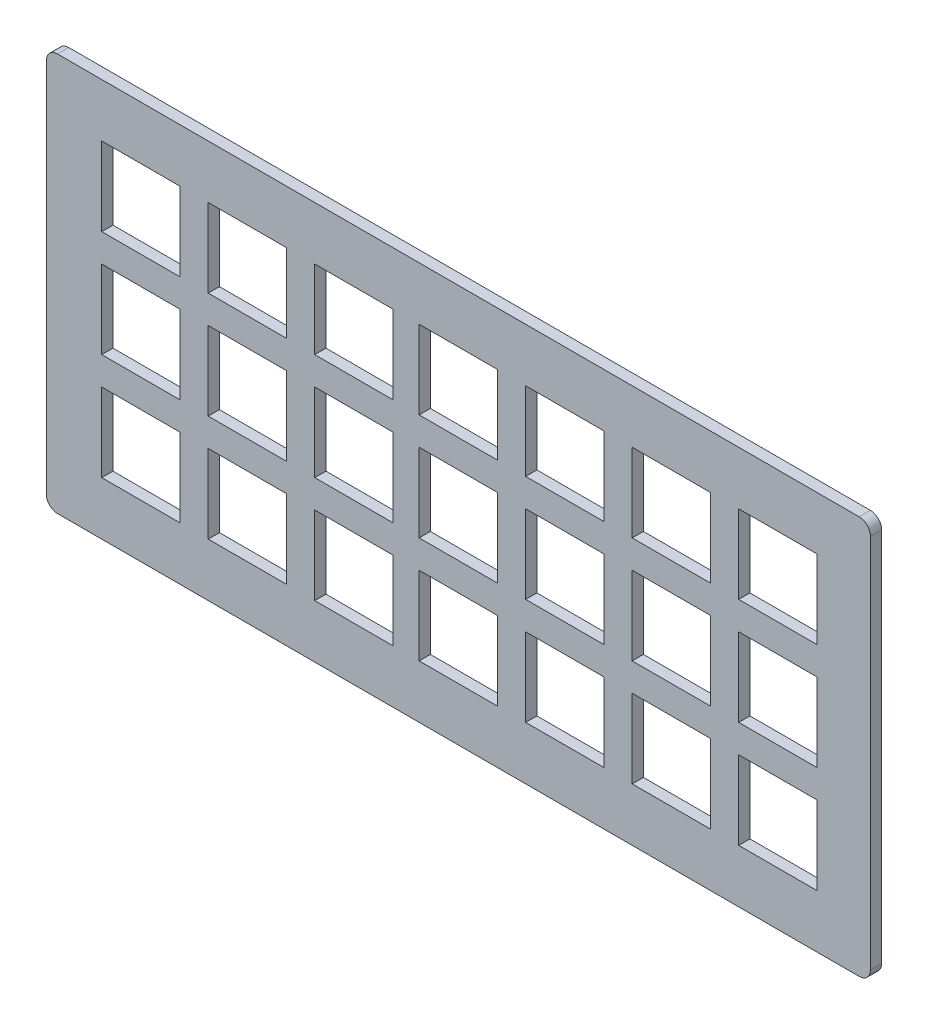
from build123d import *

# Parameters (mm, degrees)
MODEL_W             = 147
MODEL_H             = 71
MODEL_W_2           = 14
MODEL_H_2           = 14
BOSS_EXTRUDE1_DEPTH = 2
BREAK_CORNER1_DEPTH = 2


# Read off the part's stored shape, not the designer's step: Break-Corner1
with BuildPart() as part:
    # Model → Boss-Extrude1 (new body)
    with BuildSketch(Plane.XY):
        with Locations((125.770541641, 281.208862918)):
            Rectangle(MODEL_W, MODEL_H)
        with Locations((125.770541641, 262.208862918)):
            Rectangle(MODEL_W_2, MODEL_H_2, mode=Mode.SUBTRACT)
        with Locations((125.770541641, 281.208862918)):
            Rectangle(MODEL_W_2, MODEL_H_2, mode=Mode.SUBTRACT)
        with Locations((125.770541641, 300.208862918)):
            Rectangle(MODEL_W_2, MODEL_H_2, mode=Mode.SUBTRACT)
        with Locations((107.146916797, 300.208862918)):
            Rectangle(MODEL_W_2, MODEL_H_2, mode=Mode.SUBTRACT)
        with Locations((88.146916797, 300.208862918)):
            Rectangle(MODEL_W_2, MODEL_H_2, mode=Mode.SUBTRACT)
        with Locations((69.146916797, 300.208862918)):
            Rectangle(MODEL_W_2, MODEL_H_2, mode=Mode.SUBTRACT)
        with Locations((69.146916797, 281.208862918)):
            Rectangle(MODEL_W_2, MODEL_H_2, mode=Mode.SUBTRACT)
        with Locations((69.146916797, 262.208862918)):
            Rectangle(MODEL_W_2, MODEL_H_2, mode=Mode.SUBTRACT)
        with Locations((88.146916797, 281.208862918)):
            Rectangle(MODEL_W_2, MODEL_H_2, mode=Mode.SUBTRACT)
        with Locations((107.146916797, 281.208862918)):
            Rectangle(MODEL_W_2, MODEL_H_2, mode=Mode.SUBTRACT)
        with Locations((88.146916797, 262.208862918)):
            Rectangle(MODEL_W_2, MODEL_H_2, mode=Mode.SUBTRACT)
        with Locations((107.146916797, 262.208862918)):
            Rectangle(MODEL_W_2, MODEL_H_2, mode=Mode.SUBTRACT)
        with Locations((182.770541641, 300.208862918)):
            Rectangle(MODEL_W_2, MODEL_H_2, mode=Mode.SUBTRACT)
        with Locations((163.770541641, 300.208862918)):
            Rectangle(MODEL_W_2, MODEL_H_2, mode=Mode.SUBTRACT)
        with Locations((144.770541641, 300.208862918)):
            Rectangle(MODEL_W_2, MODEL_H_2, mode=Mode.SUBTRACT)
        with Locations((144.770541641, 281.208862918)):
            Rectangle(MODEL_W_2, MODEL_H_2, mode=Mode.SUBTRACT)
        with Locations((144.770541641, 262.208862918)):
            Rectangle(MODEL_W_2, MODEL_H_2, mode=Mode.SUBTRACT)
        with Locations((163.770541641, 281.208862918)):
            Rectangle(MODEL_W_2, MODEL_H_2, mode=Mode.SUBTRACT)
        with Locations((182.770541641, 281.208862918)):
            Rectangle(MODEL_W_2, MODEL_H_2, mode=Mode.SUBTRACT)
        with Locations((163.770541641, 262.208862918)):
            Rectangle(MODEL_W_2, MODEL_H_2, mode=Mode.SUBTRACT)
        with Locations((182.770541641, 262.208862918)):
            Rectangle(MODEL_W_2, MODEL_H_2, mode=Mode.SUBTRACT)
    extrude(amount=BOSS_EXTRUDE1_DEPTH)

    # Break-Corner1 outline → Break-Corner1 (cut)
    with BuildSketch(Plane.XY):
        with BuildLine():
            Line((199.270541641, 245.708862918), (199.270541641, 247.708862918))
            ThreePointArc((199.270541641, 247.708862918), (198.684755203, 246.294649356), (197.270541641, 245.708862918))
            Line((197.270541641, 245.708862918), (199.270541641, 245.708862918))
        make_face()
        with BuildLine():
            ThreePointArc((197.270541641, 316.708862918), (198.684755204, 316.123076481), (199.270541641, 314.708862918))
            Line((199.270541641, 314.708862918), (199.270541641, 316.708862918))
            Line((199.270541641, 316.708862918), (197.270541641, 316.708862918))
        make_face()
        with BuildLine():
            Line((52.270541641, 245.708862918), (54.270541641, 245.708862918))
            ThreePointArc((54.270541641, 245.708862918), (52.856328079, 246.294649356), (52.270541641, 247.708862918))
            Line((52.270541641, 247.708862918), (52.270541641, 245.708862918))
        make_face()
        with BuildLine():
            ThreePointArc((52.270541641, 314.708862918), (52.856328079, 316.123076481), (54.270541641, 316.708862918))
            Line((54.270541641, 316.708862918), (52.270541641, 316.708862918))
            Line((52.270541641, 316.708862918), (52.270541641, 314.708862918))
        make_face()
    extrude(amount=BREAK_CORNER1_DEPTH, mode=Mode.SUBTRACT)


solid = part.part
